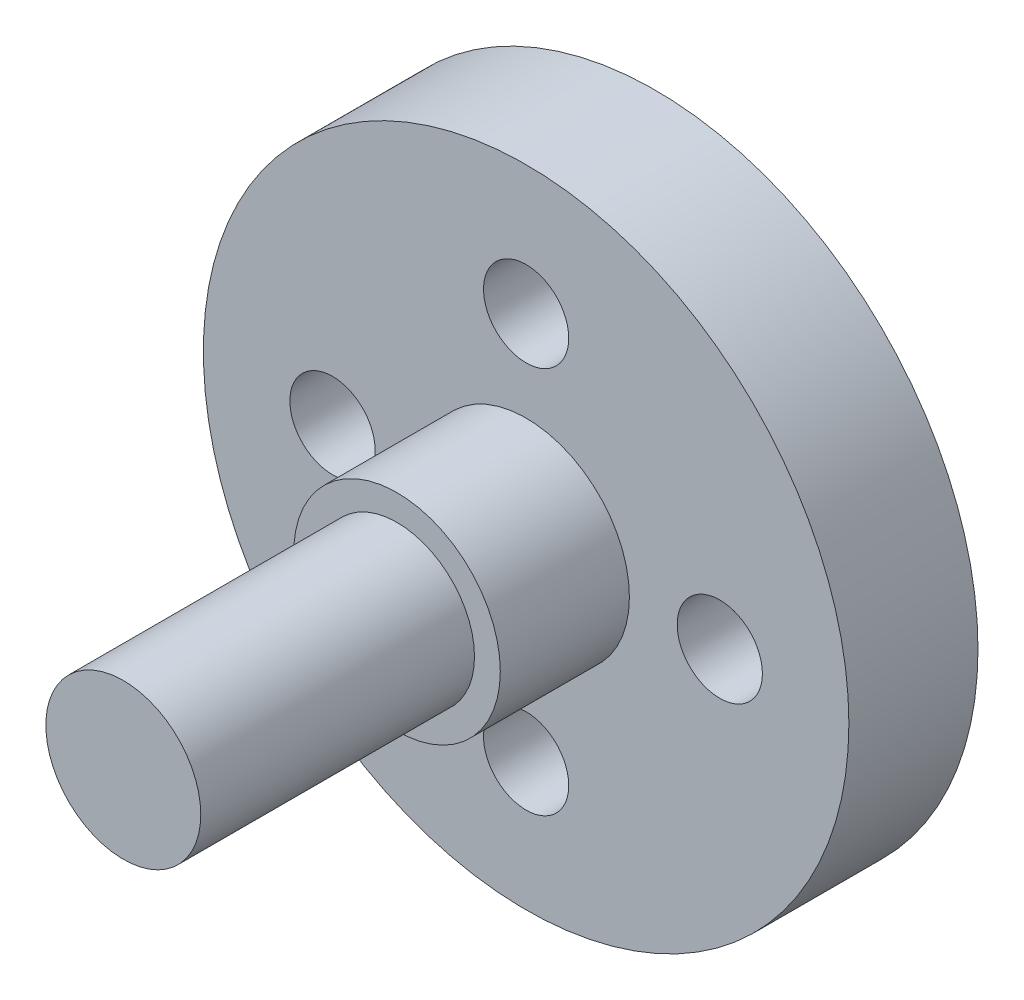
from build123d import *

# Parameters (mm, degrees)
SKETCH_1_R          = 12.5
EXTRUDE_1_DEPTH     = 5
SKETCH_2_R          = 4
EXTRUDE_2_DEPTH     = 5
SKETCH_3_R          = 3
EXTRUDE_3_DEPTH     = 10.6
SKETCH_4_R          = 1.65
CUT_EXTRUDE_1_DEPTH = 24.576683397


with BuildPart() as part:
    # ｽｹｯﾁ1 → ﾎﾞｽ - 押し出し1 (new body)
    with BuildSketch(Plane.XY):
        Circle(SKETCH_1_R)
    extrude(amount=EXTRUDE_1_DEPTH)

    # ｽｹｯﾁ2 → ﾎﾞｽ - 押し出し2 (add)
    with BuildSketch(Plane.XY.offset(5)):
        Circle(SKETCH_2_R)
    extrude(amount=EXTRUDE_2_DEPTH)

    # ｽｹｯﾁ3 → ﾎﾞｽ - 押し出し3 (add)
    with BuildSketch(Plane.XY.offset(10)):
        Circle(SKETCH_3_R)
    extrude(amount=EXTRUDE_3_DEPTH)

    # ｽｹｯﾁ4 → ｶｯﾄ - 押し出し1 (cut, through all)
    with BuildSketch(Plane.XY.offset(5)):
        with Locations((0, 7.5)):
            Circle(SKETCH_4_R)
        with Locations((7.5, 0)):
            Circle(SKETCH_4_R)
        with Locations((0, -7.5)):
            Circle(SKETCH_4_R)
        with Locations((-7.5, 0)):
            Circle(SKETCH_4_R)
    extrude(amount=-CUT_EXTRUDE_1_DEPTH, mode=Mode.SUBTRACT)


solid = part.part
